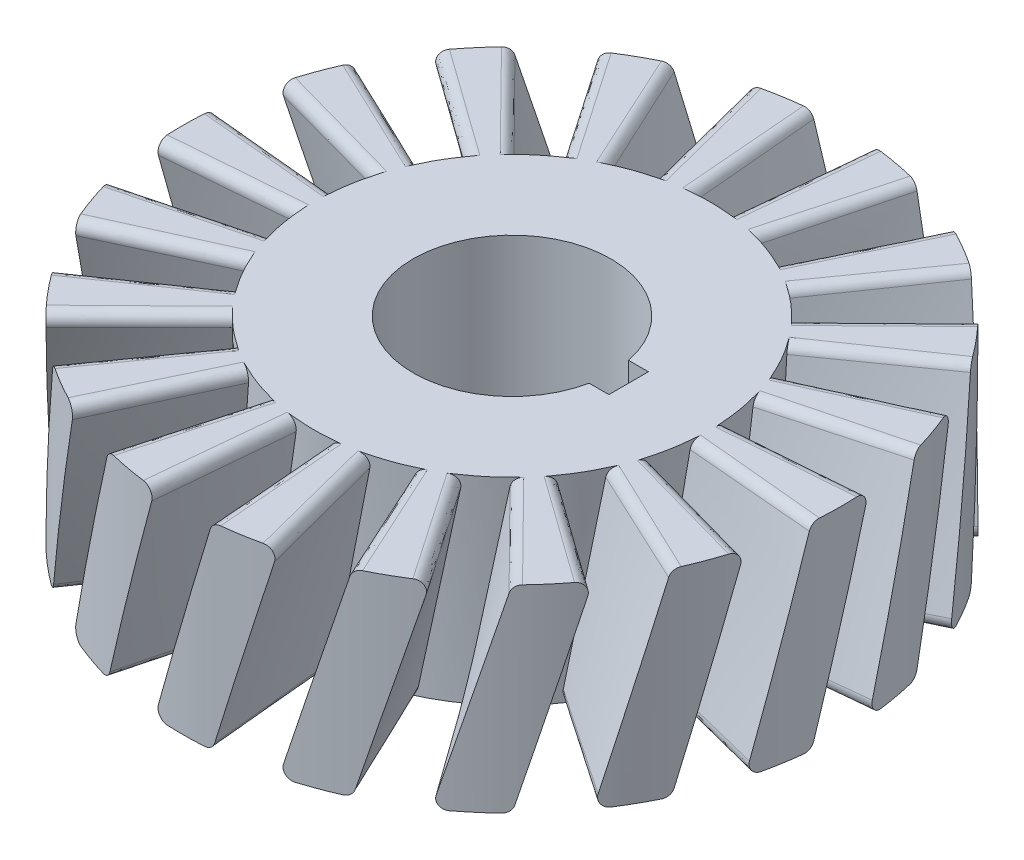
from build123d import *

# Parameters (mm, degrees)
SKETCH1_R                = 50
BOSS_EXTRUDE1_DEPTH      = 30
SKETCH2_R                = 15
CUT_EXTRUDE1_DEPTH       = 77.811457479
FILLET2_R                = 1.5
CIRPATTERN3_COUNT        = 18
FILLET2_OF_CIRPATTERN3_R = 1.5
CUT_EXTRUDE2_DEPTH       = 77.811457648


with BuildPart() as part:
    # Sketch1 → Boss-Extrude1 (new body)
    with BuildSketch(Plane(origin=(0, 0, 0), x_dir=(1, 0, 0), z_dir=(0, 1, 0))):
        Circle(SKETCH1_R)
    extrude(amount=BOSS_EXTRUDE1_DEPTH)

    # Sketch2 → Cut-Extrude1 (cut, through all)
    with BuildSketch(Plane(origin=(0, 30, 0), x_dir=(1, 0, 0), z_dir=(0, 1, 0))):
        Circle(SKETCH2_R)
    extrude(amount=-CUT_EXTRUDE1_DEPTH, mode=Mode.SUBTRACT)

    # Sketch4 for Cut-Loft1 → Cut-Loft1 section 0
    with BuildSketch(Plane(origin=(0, 0, 0), x_dir=(1, 0, 0), z_dir=(0, 1, 0))):
        with BuildLine():
            Line((29.885840943, 2.614672282), (50.805929603, 4.44494288))
            # circular arc as an exact rational Bezier (weights 1, cos(half-angle), 1)
            Bezier((50.805929603, 4.44494288), (51.194811715, 0), (50.805929603, -4.44494288), weights=[1, 0.996194698, 1])
            Line((50.805929603, -4.44494288), (29.885840943, -2.614672282))
            Bezier((29.885840943, -2.614672282), (30.114595126, 0), (29.885840943, 2.614672282), weights=[1, 0.996194698, 1])
        make_face()
    # Sketch7 for Cut-Loft1 → Cut-Loft1 section 1
    with BuildSketch(Plane(origin=(0, 30, 0), x_dir=(1, 0, 0), z_dir=(0, 1, 0))):
        with BuildLine():
            Line((28.977774789, 7.764571353), (49.262217141, 13.1997713))
            Bezier((49.262217141, 13.1997713), (50.417047491, 8.88988576), (50.805929603, 4.44494288), weights=[1, 0.996194698, 1])
            Line((50.805929603, 4.44494288), (29.885840943, 2.614672282))
            Bezier((29.885840943, 2.614672282), (29.657086759, 5.229344565), (28.977774789, 7.764571353), weights=[1, 0.996194698, 1])
        make_face()
    cut_loft1 = loft(mode=Mode.SUBTRACT)

    # Fillet2
    fillet2_edges = [part.edges().sort_by_distance(p)[0] for p in [
        (39.847787924, 30, -3.48622971),
        (38.637033052, 30, -10.352761804),
        (39.847787924, 0, 3.48622971),
        (39.847787924, 0, -3.48622971),
    ]]
    fillet(fillet2_edges, radius=FILLET2_R)

    # CirPattern3: Cut-Loft1 ×18 about axis
    cirpattern3_axis = Axis((0, -0.7, 0), (0, 1, 0))
    for i in range(1, CIRPATTERN3_COUNT):
        add(cut_loft1.rotate(cirpattern3_axis, i * 360 / CIRPATTERN3_COUNT), mode=Mode.SUBTRACT)

    # Fillet2 of CirPattern3
    fillet2_of_cirpattern3_edges = [part.edges().sort_by_distance(p)[0] for p in [
        (36.252311481, 30, -16.90473047),
        (32.766081772, 30, -22.943057454),
        (38.637033052, 0, -10.352761804),
        (36.252311481, 0, -16.90473047),
        (28.284271247, 30, -28.284271247),
        (22.943057454, 30, -32.766081772),
        (32.766081772, 0, -22.943057454),
        (28.284271247, 0, -28.284271247),
        (16.90473047, 30, -36.252311481),
        (10.352761804, 30, -38.637033052),
        (22.943057454, 0, -32.766081772),
        (16.90473047, 0, -36.252311481),
        (3.48622971, 30, -39.847787924),
        (-3.48622971, 30, -39.847787924),
        (10.352761804, 0, -38.637033052),
        (3.48622971, 0, -39.847787924),
        (-10.352761804, 30, -38.637033052),
        (-16.90473047, 30, -36.252311481),
        (-3.48622971, 0, -39.847787924),
        (-10.352761804, 0, -38.637033052),
        (-22.943057454, 30, -32.766081772),
        (-28.284271247, 30, -28.284271247),
        (-16.90473047, 0, -36.252311481),
        (-22.943057454, 0, -32.766081772),
        (-32.766081772, 30, -22.943057454),
        (-36.252311481, 30, -16.90473047),
        (-28.284271247, 0, -28.284271247),
        (-32.766081772, 0, -22.943057454),
        (-38.637033052, 30, -10.352761804),
        (-39.847787924, 30, -3.48622971),
        (-36.252311481, 0, -16.90473047),
        (-38.637033052, 0, -10.352761804),
        (-39.847787924, 30, 3.48622971),
        (-38.637033052, 30, 10.352761804),
        (-39.847787924, 0, -3.48622971),
        (-39.847787924, 0, 3.48622971),
        (-36.252311481, 30, 16.90473047),
        (-32.766081772, 30, 22.943057454),
        (-38.637033052, 0, 10.352761804),
        (-36.252311481, 0, 16.90473047),
        (-28.284271247, 30, 28.284271247),
        (-22.943057454, 30, 32.766081772),
        (-32.766081772, 0, 22.943057454),
        (-28.284271247, 0, 28.284271247),
        (-16.90473047, 30, 36.252311481),
        (-10.352761804, 30, 38.637033052),
        (-22.943057454, 0, 32.766081772),
        (-16.90473047, 0, 36.252311481),
        (-3.48622971, 30, 39.847787924),
        (3.48622971, 30, 39.847787924),
        (-10.352761804, 0, 38.637033052),
        (-3.48622971, 0, 39.847787924),
        (10.352761804, 30, 38.637033052),
        (16.90473047, 30, 36.252311481),
        (3.48622971, 0, 39.847787924),
        (10.352761804, 0, 38.637033052),
        (22.943057454, 30, 32.766081772),
        (28.284271247, 30, 28.284271247),
        (16.90473047, 0, 36.252311481),
        (22.943057454, 0, 32.766081772),
        (32.766081772, 30, 22.943057454),
        (36.252311481, 30, 16.90473047),
        (28.284271247, 0, 28.284271247),
        (32.766081772, 0, 22.943057454),
        (38.637033052, 30, 10.352761804),
        (39.847787924, 30, 3.48622971),
        (36.252311481, 0, 16.90473047),
        (38.637033052, 0, 10.352761804),
    ]]
    fillet(fillet2_of_cirpattern3_edges, radius=FILLET2_OF_CIRPATTERN3_R)

    # Sketch8 → Cut-Extrude2 (cut, through all)
    with BuildSketch(Plane(origin=(0, 0, 0), x_dir=(1, 0, 0), z_dir=(0, 1, 0))):
        with BuildLine():
            Line((14.696938457, 3), (17.696938457, 3))
            Line((17.696938457, 3), (17.696938457, -3))
            Line((17.696938457, -3), (14.696938457, -3))
            ThreePointArc((14.696938457, -3), (15, 0), (14.696938457, 3))
        make_face()
    extrude(amount=CUT_EXTRUDE2_DEPTH, mode=Mode.SUBTRACT)


solid = part.part
